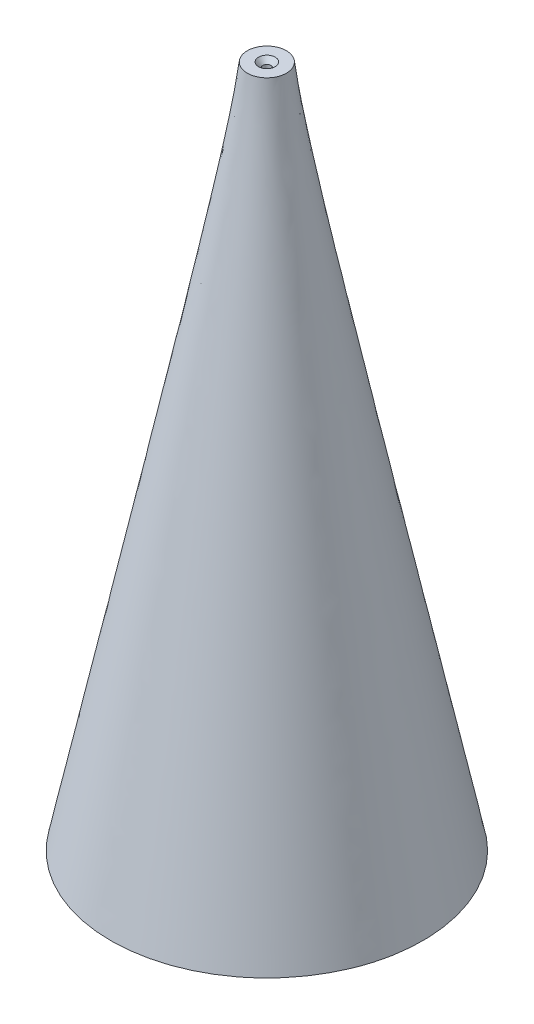
from build123d import *

# Parameters (mm, degrees)
CSK_FOR_1_FLAT_HEAD_SOCKET_CAP_SCREW1_D           = 2.0574
CSK_FOR_1_FLAT_HEAD_SOCKET_CAP_SCREW1_CSINK_D     = 4.2672
CSK_FOR_1_FLAT_HEAD_SOCKET_CAP_SCREW1_CSINK_ANGLE = 82


with BuildPart() as part:
    # Loft2: read off the stored shape, not the designer's step
    # Loft2: loft between two sections, ruled curve by curve
    loft2_from = [
        Edge.make_bspline([(-34.118731662, 0, -20.87850928), (-75.875750222, 0, 47.358954045), (-7.638286898, 0, 89.115972605), (34.118731662, 0, 20.87850928), (75.875750222, 0, -47.358954045), (7.638286898, 0, -89.115972605), (-34.118731662, 0, -20.87850928)], [0, 0, 0, 0, 0.5, 0.5, 0.5, 1, 1, 1, 1], 3, [1, 0.333333333, 0.333333333, 1, 0.333333333, 0.333333333, 1]),
    ]
    loft2_to = [
        Edge.make_bspline([(-4.762988919, 175, 1.521162896), (-1.720663127, 175, 11.047140734), (7.805314711, 175, 8.004814942), (4.762988919, 175, -1.521162896), (1.720663127, 175, -11.047140734), (-7.805314711, 175, -8.004814942), (-4.762988919, 175, 1.521162896)], [0, 0, 0, 0, 0.5, 0.5, 0.5, 1, 1, 1, 1], 3, [1, 0.333333333, 0.333333333, 1, 0.333333333, 0.333333333, 1]),
    ]
    loft2 = Solid(Shell([*[Face.make_surface_from_curves(loft2_from[k], loft2_to[k]) for k in range(1)], Face(Wire(loft2_from)), Face(Wire(loft2_to))]))
    add(loft2)

    # CSK for #1 Flat Head Socket Cap Screw1 (through all)
    with Locations(Plane(origin=(0, 175, 0), x_dir=(1, 0, 0), z_dir=(0, 1, 0))):
        with Locations((0, 0)):
            CounterSinkHole(CSK_FOR_1_FLAT_HEAD_SOCKET_CAP_SCREW1_D / 2, CSK_FOR_1_FLAT_HEAD_SOCKET_CAP_SCREW1_CSINK_D / 2, counter_sink_angle=CSK_FOR_1_FLAT_HEAD_SOCKET_CAP_SCREW1_CSINK_ANGLE)


solid = part.part
